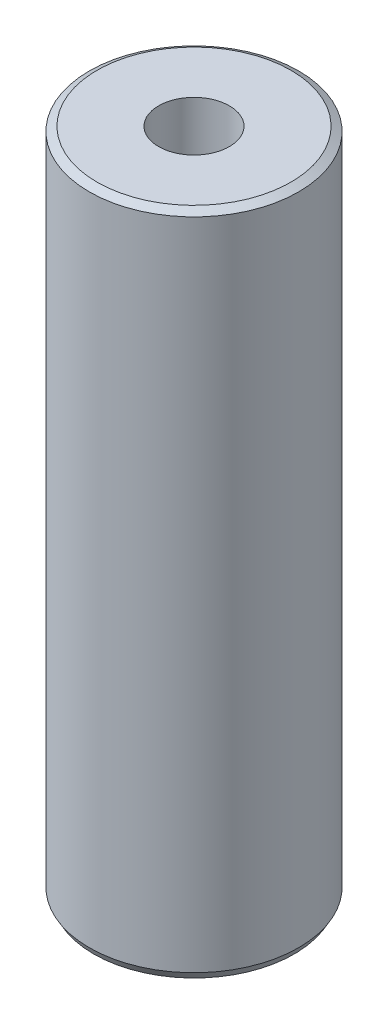
from build123d import *
from OCP.BRepFilletAPI import BRepFilletAPI_MakeChamfer

# Parameters (mm, degrees)
SKETCH1_R           = 25
BOSS_EXTRUDE1_DEPTH = 159.181617189
SKETCH2_R           = 8.445939213
CUT_EXTRUDE1_DEPTH  = 164.060685792
CHAMFER1_SIZE       = 1.0728888
CHAMFER1_SIZE2      = 1.858297912


with BuildPart() as part:
    # Sketch1 → Boss-Extrude1 (new body)
    with BuildSketch(Plane(origin=(0, 0, 0), x_dir=(1, 0, 0), z_dir=(0, 1, 0))):
        Circle(SKETCH1_R)
    extrude(amount=BOSS_EXTRUDE1_DEPTH)

    # Sketch2 → Cut-Extrude1 (cut, through all)
    with BuildSketch(Plane(origin=(0, 0, 0), x_dir=(1, 0, 0), z_dir=(0, 1, 0))):
        Circle(SKETCH2_R)
    extrude(amount=CUT_EXTRUDE1_DEPTH, mode=Mode.SUBTRACT)

    # Chamfer1: one chamfer whose edges measure the first distance from different faces: ONE call of the kernel's chamfer builder (chamfer() names one face for all edges)
    chamfer1_edges_1 = [part.edges().sort_by_distance(p)[0] for p in [
        (-25, 159.181617189, 0),
    ]]
    chamfer1_side_1 = [part.faces().sort_by_distance(p)[0] for p in [
        (-25, 79.590808595, 0),
    ]]
    chamfer1_edges_2 = [part.edges().sort_by_distance(p)[0] for p in [
        (-25, 0, 0),
    ]]
    chamfer1_side_2 = [part.faces().sort_by_distance(p)[0] for p in [
        (-24.292893219, 0, 0),
    ]]
    chamfer1 = BRepFilletAPI_MakeChamfer(part.part.solid().wrapped)
    for e in chamfer1_edges_1:
        chamfer1.Add(CHAMFER1_SIZE, CHAMFER1_SIZE2, e.wrapped, chamfer1_side_1[0].wrapped)  # the first distance lies on this face
    for e in chamfer1_edges_2:
        chamfer1.Add(CHAMFER1_SIZE, CHAMFER1_SIZE2, e.wrapped, chamfer1_side_2[0].wrapped)  # the first distance lies on this face
    add(Compound.cast(chamfer1.Shape()), mode=Mode.REPLACE)


solid = part.part
